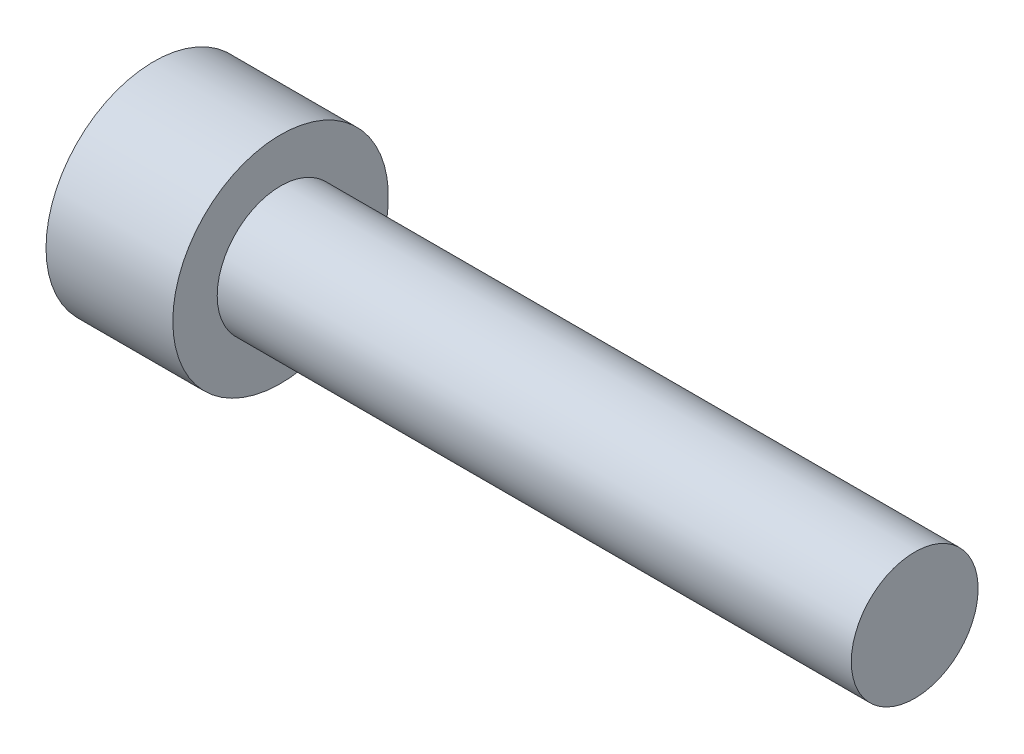
from build123d import *

# Parameters (mm, degrees)
SOCKET_DEPTH = 2.5


with BuildPart() as part:
    # Screw Sketch → Screw (revolve)
    with BuildSketch(Plane.XY):
        Polygon((-5, 0), (-5, 4.25), (0, 4.25), (0, 2.5), (25, 2.5), (25, 0), align=None)
    revolve(axis=Axis((-1000, 0, 0), (1, 0, 0)))

    # Socket Sketch → Socket (cut)
    with BuildSketch(Plane(origin=(-5, 0, 0), x_dir=(0, 0, -1), z_dir=(1, 0, 0))):
        Polygon((2.309401077, 0), (1.154700538, 2), (-1.154700538, 2), (-2.309401077, 0), (-1.154700538, -2), (1.154700538, -2), align=None)
    extrude(amount=SOCKET_DEPTH, mode=Mode.SUBTRACT)


solid = part.part
